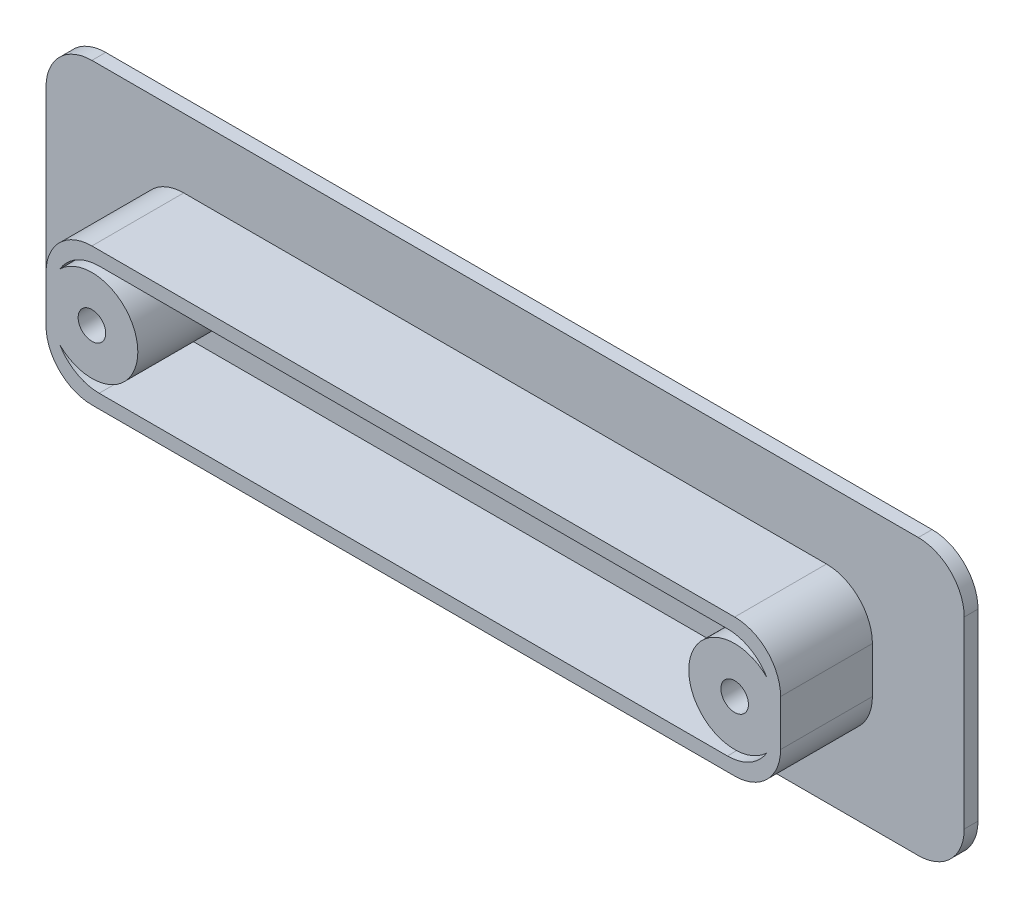
from build123d import *

# Parameters (mm, degrees)
SKETCH1_W           = 100
SKETCH1_H           = 30
BOSS_EXTRUDE1_DEPTH = 1.5
SKETCH2_W           = 80
SKETCH2_H           = 15
SKETCH2_W_2         = 77
SKETCH2_H_2         = 12
EXTRUDE_THIN1_DEPTH = 10
SKETCH3_R           = 5
BOSS_EXTRUDE2_DEPTH = 10
SKETCH4_R           = 1.5
CUT_EXTRUDE1_DEPTH  = 10
FILLET1_R           = 5


with BuildPart() as part:
    # Sketch1 → Boss-Extrude1 (new body)
    with BuildSketch(Plane.XY):
        Rectangle(SKETCH1_W, SKETCH1_H)
    extrude(amount=BOSS_EXTRUDE1_DEPTH)

    # Sketch2 → Extrude-Thin1 (add)
    with BuildSketch(Plane.XY.offset(1.5)):
        Rectangle(SKETCH2_W, SKETCH2_H)
        Rectangle(SKETCH2_W_2, SKETCH2_H_2, mode=Mode.SUBTRACT)
    extrude(amount=EXTRUDE_THIN1_DEPTH)

    # Sketch3 → Boss-Extrude2 (add)
    with BuildSketch(Plane.XY.offset(1.5)):
        with Locations((-35, 0)):
            Circle(SKETCH3_R)
        with Locations((35, 0)):
            Circle(SKETCH3_R)
    extrude(amount=BOSS_EXTRUDE2_DEPTH)

    # Sketch4 → Cut-Extrude1 (cut)
    with BuildSketch(Plane.XY.offset(11.5)):
        with Locations((-35, 0)):
            Circle(SKETCH4_R)
        with Locations(Location((35, 0, 0), (0, 0, 180))):
            Circle(SKETCH4_R)
    extrude(amount=-CUT_EXTRUDE1_DEPTH, mode=Mode.SUBTRACT)

    # Fillet1
    # the kernel refuses this fillet: 5 mm, written as the material it adds along each edge
    with BuildSketch(Plane(origin=(38.5, -6, 1.5), x_dir=(0, 1, 0), z_dir=(0, 0, 1))) as fillet1_piece_1:
        with BuildLine():
            CenterArc((5, 4.288522873), FILLET1_R, 180, 59.059821395)
            Line((0, 4.288522873), (0, 0))
            Line((0, 0), (2.429285786, 0))
        make_face()
    extrude(amount=10)
    with BuildSketch(Plane(origin=(38.5, 6, 1.5), x_dir=(0, -1, 0), z_dir=(0, 0, 1))) as fillet1_piece_2:
        with BuildLine():
            CenterArc((5, -4.288522873), FILLET1_R, 120.940178605, 59.059821395)
            Line((0, -4.288522873), (0, 0))
            Line((0, 0), (2.429285786, 0))
        make_face()
    extrude(amount=10)
    with BuildSketch(Plane(origin=(-38.5, -6, 1.5), x_dir=(1, 0, 0), z_dir=(0, 0, 1))) as fillet1_piece_3:
        with BuildLine():
            CenterArc((4.288522873, 5), FILLET1_R, 210.940178605, 59.059821395)
            Line((0, 2.429285786), (0, 0))
            Line((0, 0), (4.288522873, 0))
        make_face()
    extrude(amount=10)
    with BuildSketch(Plane(origin=(-38.5, 6, 1.5), x_dir=(1, 0, 0), z_dir=(0, 0, 1))) as fillet1_piece_4:
        with BuildLine():
            CenterArc((4.288522873, -5), FILLET1_R, 90, 59.059821395)
            Line((0, -2.429285786), (0, 0))
            Line((0, 0), (4.288522873, 0))
        make_face()
    extrude(amount=10)
    # the kernel refuses this fillet: 5 mm, written as the material it takes off along each edge
    with BuildSketch(Plane(origin=(40, 7.5, 1.5), x_dir=(0, -1, 0), z_dir=(0, 0, 1)), Plane(origin=(40, -7.5, 1.5), x_dir=(-1, 0, 0), z_dir=(0, 0, 1)), Plane(origin=(-40, 7.5, 1.5), x_dir=(1, 0, 0), z_dir=(0, 0, 1))) as fillet1_2_piece_1:
        with BuildLine():
            CenterArc((FILLET1_R, -FILLET1_R), FILLET1_R, 90, 90)
            Line((0, -FILLET1_R), (0, 0))
            Line((0, 0), (FILLET1_R, 0))
        make_face()
    extrude(amount=22.5, mode=Mode.SUBTRACT)
    with BuildSketch(Plane(origin=(-40, -7.5, 1.5), x_dir=(1, 0, 0), z_dir=(0, 0, 1))) as fillet1_2_piece_2:
        with BuildLine():
            CenterArc((FILLET1_R, FILLET1_R), FILLET1_R, 180, 90)
            Line((0, FILLET1_R), (0, 0))
            Line((0, 0), (FILLET1_R, 0))
        make_face()
    extrude(amount=22.5, mode=Mode.SUBTRACT)
    with BuildSketch(Plane(origin=(-50, 15, -12.5), x_dir=(1, 0, 0), z_dir=(0, 0, 1)), Plane(origin=(-50, -15, -12.5), x_dir=(0, 1, 0), z_dir=(0, 0, 1))) as fillet1_2_piece_3:
        with BuildLine():
            CenterArc((FILLET1_R, -FILLET1_R), FILLET1_R, 90, 90)
            Line((0, -FILLET1_R), (0, 0))
            Line((0, 0), (FILLET1_R, 0))
        make_face()
    extrude(amount=26.5, mode=Mode.SUBTRACT)
    with BuildSketch(Plane(origin=(50, -15, -12.5), x_dir=(0, 1, 0), z_dir=(0, 0, 1)), Plane(origin=(50, 15, -12.5), x_dir=(-1, 0, 0), z_dir=(0, 0, 1))) as fillet1_2_piece_4:
        with BuildLine():
            CenterArc((FILLET1_R, FILLET1_R), FILLET1_R, 180, 90)
            Line((0, FILLET1_R), (0, 0))
            Line((0, 0), (FILLET1_R, 0))
        make_face()
    extrude(amount=26.5, mode=Mode.SUBTRACT)


solid = part.part
